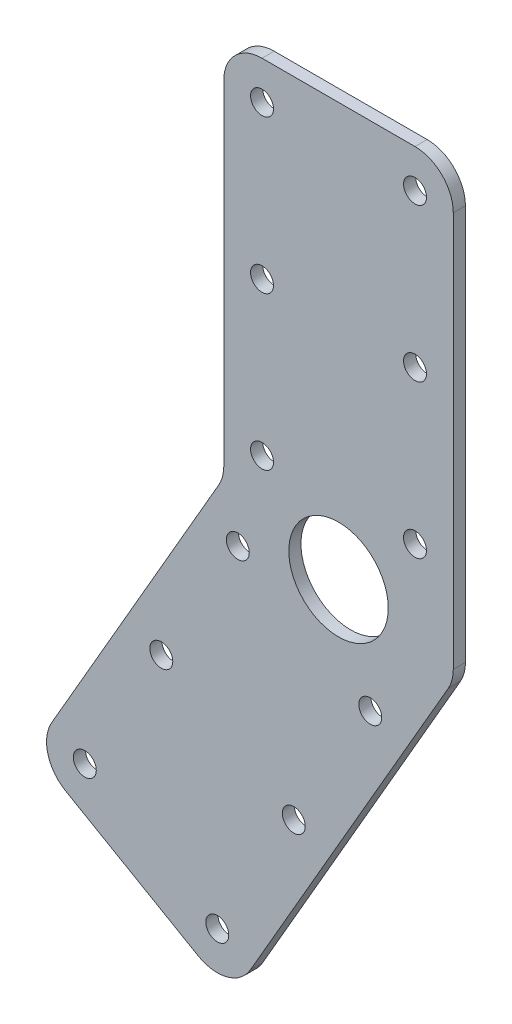
from build123d import *

# Parameters (mm, degrees)
SKETCH1_R           = 6.5
SKETCH1_R_2         = 1.5
BOSS_EXTRUDE1_DEPTH = 1.5875
FILLET1_R           = 5


with BuildPart() as part:
    # Sketch1 → Boss-Extrude1 (new body)
    with BuildSketch(Plane.XY):
        Polygon((0, 0), (0, 50), (30, 50), (30, -8.038475773), (0.980762114, -58.301270189), (-25, -43.301270189), align=None)
        with Locations((15, -4.019237886)):
            Circle(SKETCH1_R, mode=Mode.SUBTRACT)
        with Locations((5, 45)):
            Circle(SKETCH1_R_2, mode=Mode.SUBTRACT)
        with Locations((5, 25)):
            Circle(SKETCH1_R_2, mode=Mode.SUBTRACT)
        with Locations((5, 5)):
            Circle(SKETCH1_R_2, mode=Mode.SUBTRACT)
        with Locations((25, 5)):
            Circle(SKETCH1_R_2, mode=Mode.SUBTRACT)
        with Locations((25, 25)):
            Circle(SKETCH1_R_2, mode=Mode.SUBTRACT)
        with Locations((25, 45)):
            Circle(SKETCH1_R_2, mode=Mode.SUBTRACT)
        with Locations((-18.169872981, -41.47114317)):
            Circle(SKETCH1_R_2, mode=Mode.SUBTRACT)
        with Locations((-8.169872981, -24.150635095)):
            Circle(SKETCH1_R_2, mode=Mode.SUBTRACT)
        with Locations((1.830127019, -6.830127019)):
            Circle(SKETCH1_R_2, mode=Mode.SUBTRACT)
        with Locations((19.150635095, -16.830127019)):
            Circle(SKETCH1_R_2, mode=Mode.SUBTRACT)
        with Locations((9.150635095, -34.150635095)):
            Circle(SKETCH1_R_2, mode=Mode.SUBTRACT)
        with Locations((-0.849364905, -51.47114317)):
            Circle(SKETCH1_R_2, mode=Mode.SUBTRACT)
    extrude(amount=BOSS_EXTRUDE1_DEPTH)

    # Fillet1
    fillet1_edges = [part.edges().sort_by_distance(p)[0] for p in [
        (30, -8.038475773, 0.79375),
        (0, 0, 0.79375),
        (0.980762114, -58.301270189, 0.79375),
        (-25, -43.301270189, 0.79375),
        (0, 50, 0.79375),
        (30, 50, 0.79375),
    ]]
    fillet(fillet1_edges, radius=FILLET1_R)


solid = part.part
